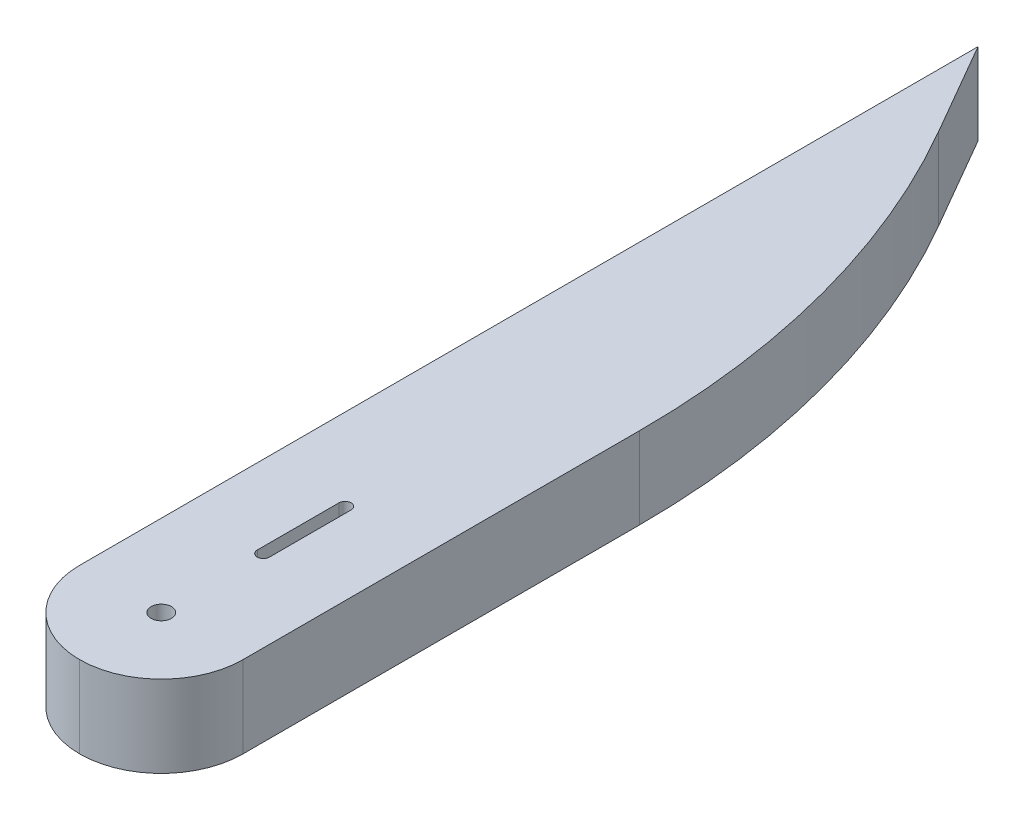
from build123d import *

# Parameters (mm, degrees)
SKETCH1_W           = 50.8
SKETCH1_H           = 25.4
BOSS_EXTRUDE1_DEPTH = 304.8
FILLET1_R           = 25.4
CUT_EXTRUDE1_DEPTH  = 311.04651264
FILLET2_R           = 254
SKETCH7_R           = 3.175
CUT_EXTRUDE2_DEPTH  = 311.04651264
CUT_EXTRUDE3_DEPTH  = 311.04651264


with BuildPart() as part:
    # Sketch1 → Boss-Extrude1 (new body)
    with BuildSketch(Plane.XY):
        with Locations((-25.4, 12.7)):
            Rectangle(SKETCH1_W, SKETCH1_H)
    extrude(amount=BOSS_EXTRUDE1_DEPTH)

    # Fillet1
    fillet1_edges = [part.edges().sort_by_distance(p)[0] for p in [
        (0, 12.7, 304.8),
        (-50.8, 12.7, 304.8),
    ]]
    fillet(fillet1_edges, radius=FILLET1_R - 0.0001)  # a hair under: the kernel refuses the full size

    # Sketch6 → Cut-Extrude1 (cut, through all)
    with BuildSketch(Plane(origin=(0, 25.4, 0), x_dir=(1, 0, 0), z_dir=(0, 1, 0))):
        Polygon((-50.8, 0), (0, -87.988181024), (0, 0), align=None)
    extrude(amount=-CUT_EXTRUDE1_DEPTH, mode=Mode.SUBTRACT)

    # Fillet2
    fillet2_edges = [part.edges().sort_by_distance(p)[0] for p in [
        (0, 12.7, 87.988181024),
    ]]
    fillet(fillet2_edges, radius=FILLET2_R)

    # Sketch7 → Cut-Extrude2 (cut, through all)
    with BuildSketch(Plane(origin=(0, 25.4, 0), x_dir=(1, 0, 0), z_dir=(0, 1, 0))):
        with Locations(Location((-25.4, -279.4, 0), (0, 0, 180))):
            Circle(SKETCH7_R)
    extrude(amount=-CUT_EXTRUDE2_DEPTH, mode=Mode.SUBTRACT)

    # Sketch8 → Cut-Extrude3 (cut, through all)
    with BuildSketch(Plane(origin=(0, 25.4, 0), x_dir=(1, 0, 0), z_dir=(0, 1, 0))):
        with BuildLine():
            Line((-27.305, -247.65), (-27.305, -222.25))
            ThreePointArc((-27.305, -222.25), (-25.4, -220.345), (-23.495, -222.25))
            Line((-23.495, -222.25), (-23.495, -247.65))
            ThreePointArc((-23.495, -247.65), (-25.4, -249.555), (-27.305, -247.65))
        make_face()
    extrude(amount=-CUT_EXTRUDE3_DEPTH, mode=Mode.SUBTRACT)


solid = part.part
